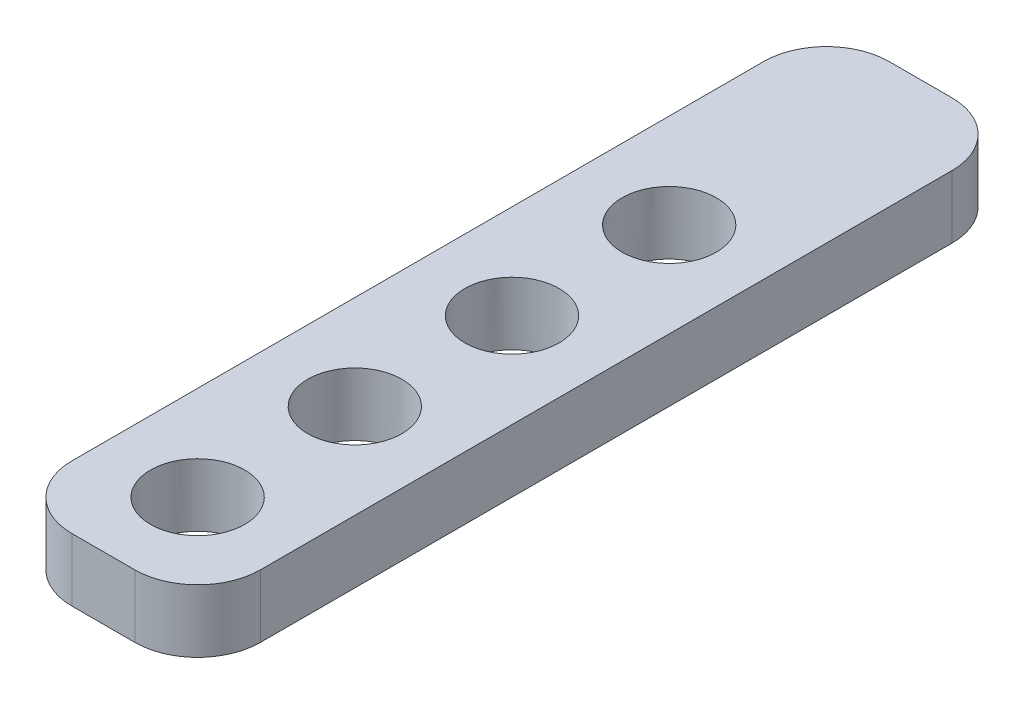
from build123d import *

# Parameters (mm, degrees)
SKETCH1_W           = 30
SKETCH1_H           = 130
BOSS_EXTRUDE1_DEPTH = 10
FILLET1_R           = 10
CUT_EXTRUDE1_REACH  = 135.791
SKETCH2_R           = 7.5
LPATTERN1_COUNT     = 4
LPATTERN1_PITCH     = 25


with BuildPart() as part:
    # Sketch1 → Boss-Extrude1 (new body)
    with BuildSketch(Plane(origin=(0, 0, 0), x_dir=(1, 0, 0), z_dir=(0, 1, 0))):
        with Locations((15, 65)):
            Rectangle(SKETCH1_W, SKETCH1_H)
    extrude(amount=BOSS_EXTRUDE1_DEPTH)

    # Fillet1
    fillet1_edges = [part.edges().sort_by_distance(p)[0] for p in [
        (30, 5, -130),
        (30, 5, 0),
        (0, 5, 0),
        (0, 5, -130),
    ]]
    fillet(fillet1_edges, radius=FILLET1_R)

    # Sketch2 → Cut-Extrude1 (cut, up to next)
    with BuildSketch(Plane(origin=(0, 10, 0), x_dir=(1, 0, 0), z_dir=(0, 1, 0)), mode=Mode.PRIVATE) as cut_extrude1_sk1:
        with Locations((15, 15)):
            Circle(SKETCH2_R)
    cut_extrude1_tool1 = extrude(cut_extrude1_sk1.sketch, amount=-CUT_EXTRUDE1_REACH, mode=Mode.PRIVATE) & part.part
    cut_extrude1 = cut_extrude1_tool1.solids().sort_by_distance((15, 10, -15))[0]
    add(cut_extrude1, mode=Mode.SUBTRACT)

    # LPattern1: Cut-Extrude1 ×4
    with Locations(*[(0, 0, -i * LPATTERN1_PITCH) for i in range(1, LPATTERN1_COUNT)]):
        add(cut_extrude1, mode=Mode.SUBTRACT)


solid = part.part
